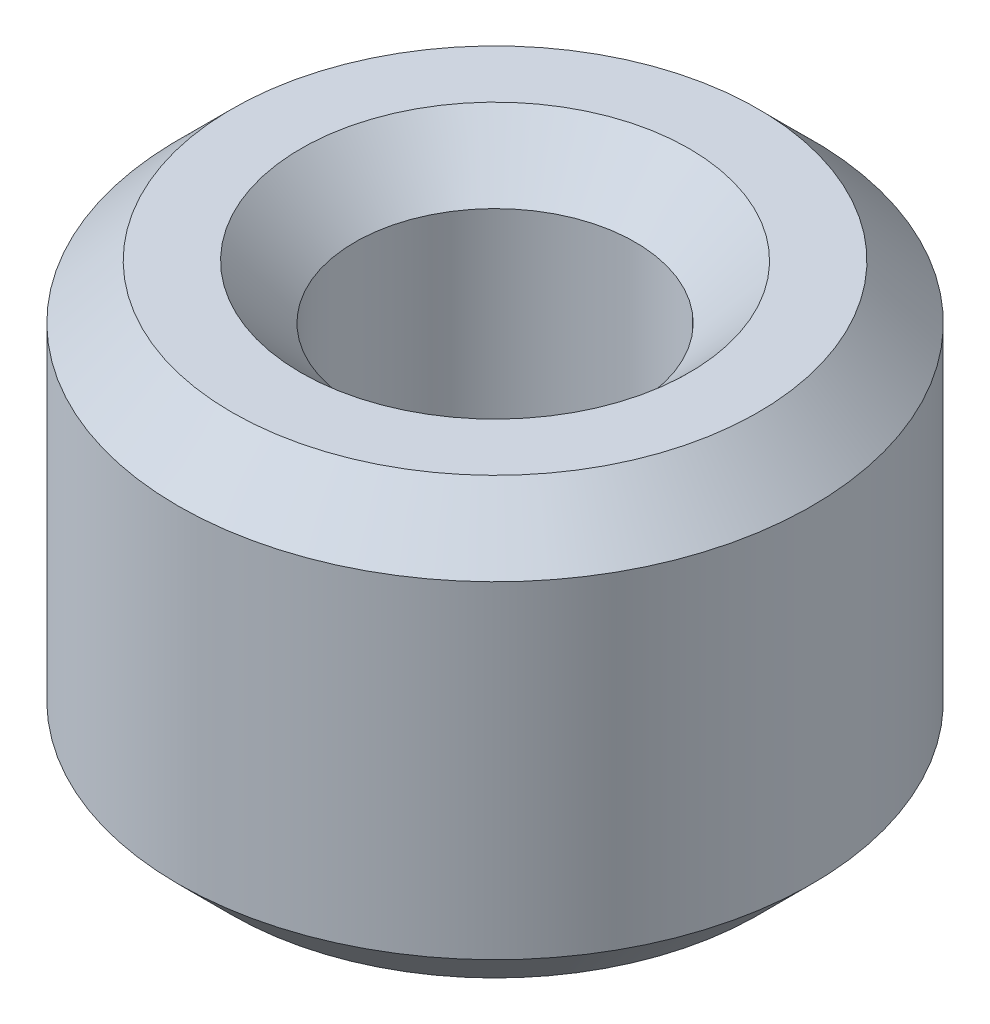
from build123d import *

# Parameters (mm, degrees)
SKETCH1_R           = 15
BOSS_EXTRUDE1_DEPTH = 20.600221255
SKETCH2_R           = 6.631294821
CUT_EXTRUDE1_DEPTH  = 30.569733103
CHAMFER1_SIZE       = 2.555267726


with BuildPart() as part:
    # Sketch1 → Boss-Extrude1 (new body)
    with BuildSketch(Plane(origin=(0, 0, 0), x_dir=(1, 0, 0), z_dir=(0, 1, 0))):
        Circle(SKETCH1_R)
    extrude(amount=BOSS_EXTRUDE1_DEPTH)

    # Sketch2 → Cut-Extrude1 (cut, through all)
    with BuildSketch(Plane(origin=(0, 0, 0), x_dir=(1, 0, 0), z_dir=(0, 1, 0))):
        Circle(SKETCH2_R)
    extrude(amount=CUT_EXTRUDE1_DEPTH, mode=Mode.SUBTRACT)

    # Chamfer1
    chamfer1_edges = [part.edges().sort_by_distance(p)[0] for p in [
        (-6.631294821, 20.600221255, 0),
        (-6.631294821, 0, 0),
        (-15, 0, 0),
        (-15, 20.600221255, 0),
    ]]
    chamfer(chamfer1_edges, length=CHAMFER1_SIZE)


solid = part.part
